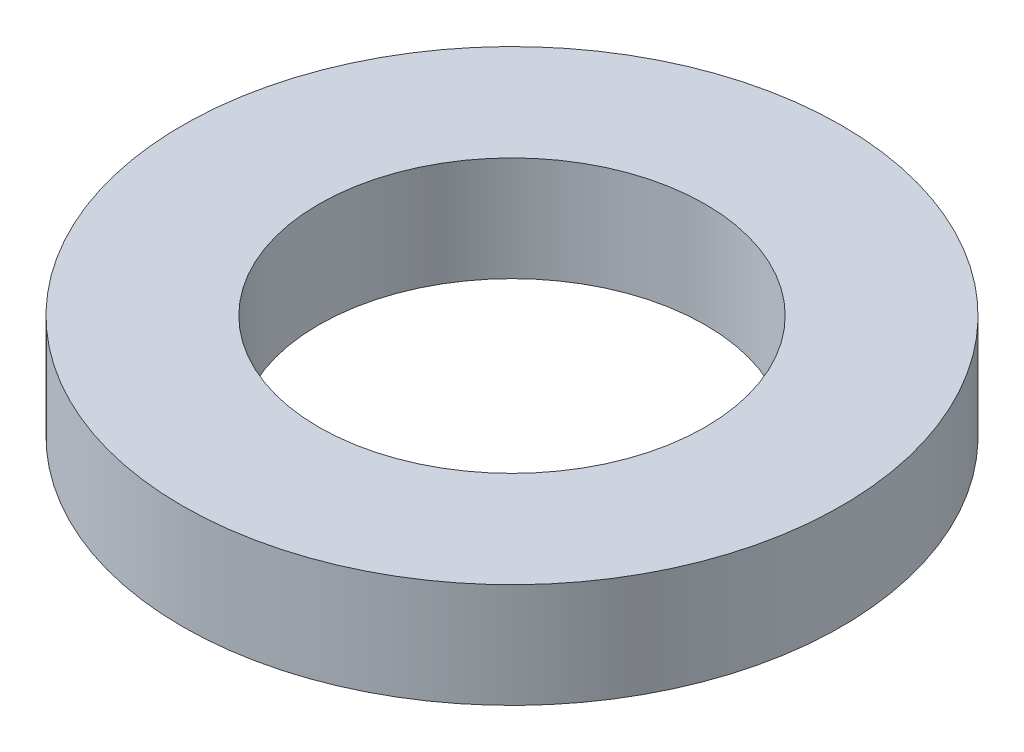
from build123d import *

# Parameters (mm, degrees)
SKETCH1_R           = 72.5
BOSS_EXTRUDE1_DEPTH = 23
SKETCH2_R           = 42.5
CUT_EXTRUDE1_DEPTH  = 106.078542053


with BuildPart() as part:
    # Sketch1 → Boss-Extrude1 (new body)
    with BuildSketch(Plane(origin=(0, 0, 0), x_dir=(1, 0, 0), z_dir=(0, 1, 0))):
        Circle(SKETCH1_R)
    extrude(amount=BOSS_EXTRUDE1_DEPTH)

    # Sketch2 → Cut-Extrude1 (cut, through all)
    with BuildSketch(Plane(origin=(0, 0, 0), x_dir=(1, 0, 0), z_dir=(0, 1, 0))):
        Circle(SKETCH2_R)
    extrude(amount=CUT_EXTRUDE1_DEPTH, mode=Mode.SUBTRACT)


solid = part.part
